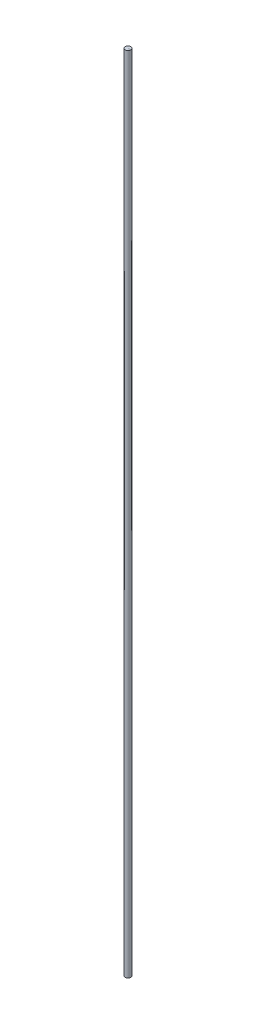
from build123d import *

# Parameters (mm, degrees)
SKETCH1_R           = 2
BOSS_EXTRUDE1_DEPTH = 575
BOSS_EXTRUDE2_DEPTH = 0.0254


with BuildPart() as part:
    # Sketch1 → Boss-Extrude1 (new body)
    with BuildSketch(Plane(origin=(0, 0, 0), x_dir=(1, 0, 0), z_dir=(0, 1, 0))):
        Circle(SKETCH1_R)
    extrude(amount=BOSS_EXTRUDE1_DEPTH)

    # Sketch2 → Boss-Extrude2 (add)
    with BuildSketch(Plane(origin=(0, 575, 0), x_dir=(1, 0, 0), z_dir=(0, 1, 0))):
        Polygon((0, 0), (2, 0), (0, -0.161399324), align=None)
    boss_extrude2 = extrude(amount=BOSS_EXTRUDE2_DEPTH)

    # Mirror1: Boss-Extrude2 across plane
    add(boss_extrude2.mirror(Plane.ZX.offset(287.5)))


solid = part.part
